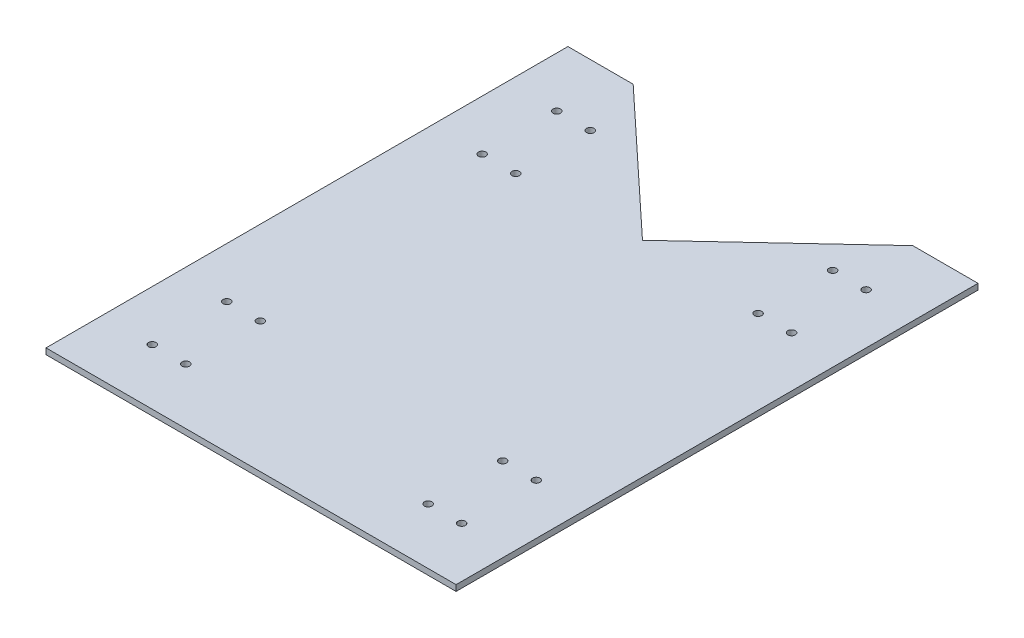
from build123d import *

# Parameters (mm, degrees)
SKETCH3_W           = 220
SKETCH3_H           = 280
BOSS_EXTRUDE1_DEPTH = 3.175
SKETCH7_R           = 2
SKETCH7_R_2         = 2.000000006
SKETCH7_R_3         = 1.999999994
CUT_EXTRUDE2_DEPTH  = 10
CUT_EXTRUDE4_DEPTH  = 10


with BuildPart() as part:
    # Sketch3 → Boss-Extrude1 (new body)
    with BuildSketch(Plane(origin=(0, 0, 0), x_dir=(1, 0, 0), z_dir=(0, 1, 0))):
        Rectangle(SKETCH3_W, SKETCH3_H)
    extrude(amount=BOSS_EXTRUDE1_DEPTH)

    # Sketch7 → Cut-Extrude2 (cut)
    with BuildSketch(Plane.XZ):
        with Locations((-83, 70)):
            Circle(SKETCH7_R)
        with Locations((-83, 110)):
            Circle(SKETCH7_R)
        with Locations((-65, 110)):
            Circle(SKETCH7_R_2)
        with Locations((-65, 70)):
            Circle(SKETCH7_R)
        with Locations((65, 110)):
            Circle(SKETCH7_R_3)
        with Locations((83, 110)):
            Circle(SKETCH7_R)
        with Locations((83, 70)):
            Circle(SKETCH7_R)
        with Locations((65, 70)):
            Circle(SKETCH7_R)
        with Locations((83, -107)):
            Circle(SKETCH7_R)
        with Locations((65, -67)):
            Circle(SKETCH7_R)
        with Locations((83, -67)):
            Circle(SKETCH7_R)
        with Locations((65, -107)):
            Circle(SKETCH7_R)
        with Locations((-65, -107)):
            Circle(SKETCH7_R)
        with Locations((-83, -107)):
            Circle(SKETCH7_R)
        with Locations((-83, -67)):
            Circle(SKETCH7_R)
        with Locations((-65, -67)):
            Circle(SKETCH7_R)
    extrude(amount=-CUT_EXTRUDE2_DEPTH, mode=Mode.SUBTRACT)

    # Sketch9 → Cut-Extrude4 (cut)
    with BuildSketch(Plane(origin=(0, 3.175, 0), x_dir=(1, 0, 0), z_dir=(0, 1, 0))):
        Polygon((0, 70), (75, 140), (-75, 140), align=None)
    extrude(amount=-CUT_EXTRUDE4_DEPTH, mode=Mode.SUBTRACT)


solid = part.part
